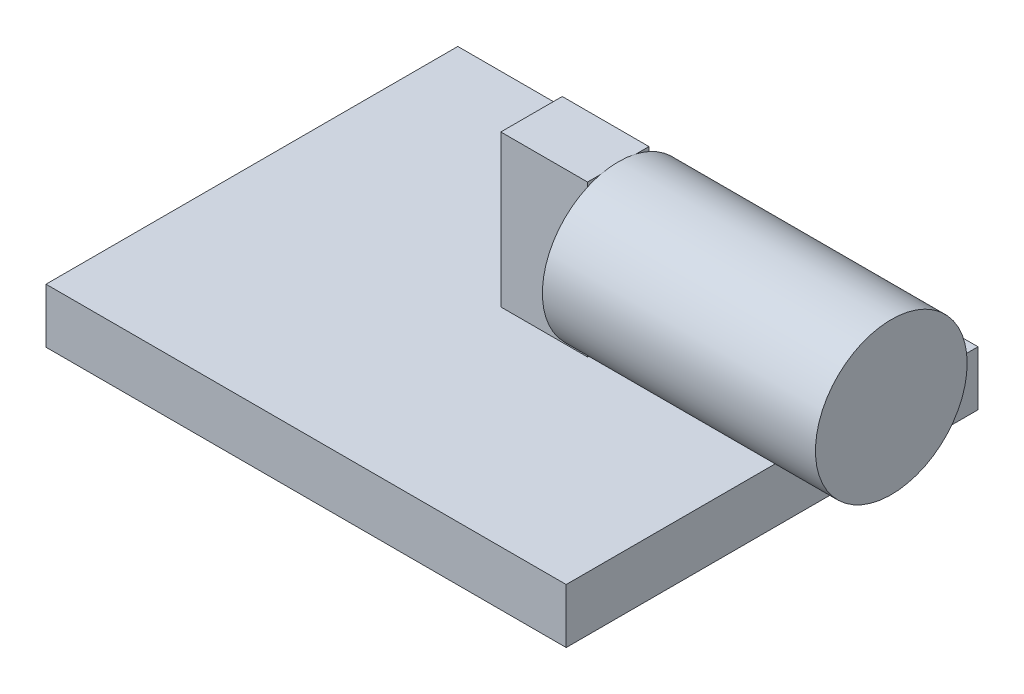
from build123d import *

# Parameters (mm, degrees)
SKETCH1_W               = 19.05
SKETCH1_H               = 15.08125
BOARD_DEPTH             = 2
SKETCH2_R               = 2.778125
LASERBARREL_DEPTH       = 10
SKETCH4_W               = 2.25
SKETCH4_H               = 5.55
BARREL_BUTT_MOUNT_DEPTH = 3.175


with BuildPart() as part:
    # Sketch1 → Board (new body)
    with BuildSketch(Plane(origin=(0, 0, 0), x_dir=(1, 0, 0), z_dir=(0, 1, 0))):
        Rectangle(SKETCH1_W, SKETCH1_H)
    extrude(amount=BOARD_DEPTH)



with BuildPart() as body_2:
    # Sketch2 → LaserBarrel (new body)
    with BuildSketch(Plane(origin=(12.7, 0, 0), x_dir=(0, 0, -1), z_dir=(1, 0, 0))):
        with Locations((1.190625, 4.85)):
            Circle(SKETCH2_R)
    extrude(amount=-LASERBARREL_DEPTH)


with BuildPart() as part_1:
    add(part.part)

    add(body_2.part)  # Barrel Butt Mount merges body 2
    # Sketch4 → Barrel Butt Mount (add)
    with BuildSketch(Plane.ZY.offset(-2.7)):
        with Locations((-1.190625, 4.775)):
            Rectangle(SKETCH4_W, SKETCH4_H)
    extrude(amount=BARREL_BUTT_MOUNT_DEPTH)


solid = part_1.part
